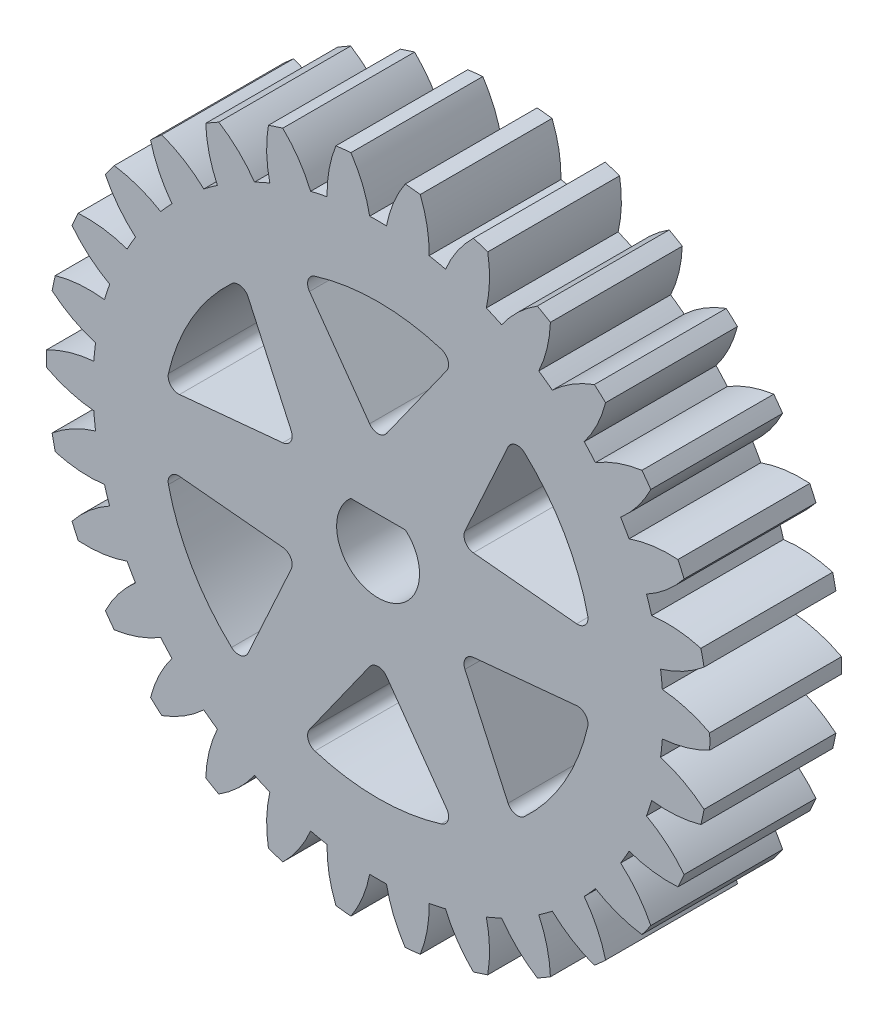
from build123d import *

# Parameters (mm, degrees)
SKETCH1_R                = 16
BOSS_EXTRUDE1_DEPTH      = 6.36
CUT_EXTRUDE1_DEPTH       = 24.504246425
CIRPATTERN1_COUNT        = 30
CUT_EXTRUDE4_DEPTH       = 24.467713412
CUT_EXTRUDE5_DEPTH       = 24.467713412
FILLET3_R                = 0.5
CIRPATTERN2_COUNT        = 6
FILLET3_OF_CIRPATTERN2_R = 0.5


with BuildPart() as part:
    # Sketch1 → Boss-Extrude1 (new body)
    with BuildSketch(Plane.XY):
        Circle(SKETCH1_R)
    extrude(amount=BOSS_EXTRUDE1_DEPTH)

    # Sketch3 → Cut-Extrude1 (cut, through all)
    with BuildSketch(Plane.XY.offset(6.36)):
        with BuildLine():
            ThreePointArc((-1.309972212, 15.946283981), (-0.747286699, 14.890480207), (-0.405262886, 13.744026411))
            ThreePointArc((-0.405262886, 13.744026411), (0, 13.75), (0.405262886, 13.744026411))
            ThreePointArc((0.405262886, 13.744026411), (0.747286699, 14.890480207), (1.309972212, 15.946283981))
            ThreePointArc((1.309972212, 15.946283981), (0, 16), (-1.309972212, 15.946283981))
        make_face()
    cut_extrude1 = extrude(amount=-CUT_EXTRUDE1_DEPTH, mode=Mode.SUBTRACT)

    # CirPattern1: Cut-Extrude1 ×30 about axis
    cirpattern1_axis = Axis((0, 0, 6.36), (0, 0, -1))
    for i in range(1, CIRPATTERN1_COUNT):
        add(cut_extrude1.rotate(cirpattern1_axis, i * 360 / CIRPATTERN1_COUNT), mode=Mode.SUBTRACT)

    # Sketch6 → Cut-Extrude4 (cut, through all)
    with BuildSketch(Plane(origin=(0, 0, 0), x_dir=(-1, 0, 0), z_dir=(0, 0, -1))):
        with BuildLine():
            Line((1.322875656, 1.5), (-1.322875656, 1.5))
            ThreePointArc((-1.322875656, 1.5), (0, -2), (1.322875656, 1.5))
        make_face()
    extrude(amount=-CUT_EXTRUDE4_DEPTH, mode=Mode.SUBTRACT)

    # Sketch7 → Cut-Extrude5 (cut, through all)
    with BuildSketch(Plane(origin=(0, 0, 0), x_dir=(-1, 0, 0), z_dir=(0, 0, -1))):
        with BuildLine():
            Line((0, 4.5), (3.695723463, 9.694444444))
            ThreePointArc((3.695723463, 9.694444444), (0, 10.375), (-3.695723463, 9.694444444))
            Line((-3.695723463, 9.694444444), (0, 4.5))
        make_face()
    cut_extrude5 = extrude(amount=-CUT_EXTRUDE5_DEPTH, mode=Mode.SUBTRACT)

    # Fillet3
    fillet3_edges = [part.edges().sort_by_distance(p)[0] for p in [
        (0, 4.5, 3.18),
        (-3.695723463, 9.694444444, 3.18),
        (3.695723463, 9.694444444, 3.18),
    ]]
    fillet(fillet3_edges, radius=FILLET3_R)

    # CirPattern2: Cut-Extrude5 ×6 about axis
    cirpattern2_axis = Axis((0, 0, 0), (0, 0, 1))
    for i in range(1, CIRPATTERN2_COUNT):
        add(cut_extrude5.rotate(cirpattern2_axis, i * 360 / CIRPATTERN2_COUNT), mode=Mode.SUBTRACT)

    # Fillet3 of CirPattern2
    fillet3_of_cirpattern2_edges = [part.edges().sort_by_distance(p)[0] for p in [
        (-3.897114317, 2.25, 3.18),
        (-10.243496896, 1.646631818, 3.18),
        (-6.547773433, 8.047812626, 3.18),
        (-3.897114317, -2.25, 3.18),
        (-6.547773433, -8.047812626, 3.18),
        (-10.243496896, -1.646631818, 3.18),
        (0, -4.5, 3.18),
        (3.695723463, -9.694444444, 3.18),
        (-3.695723463, -9.694444444, 3.18),
        (3.897114317, -2.25, 3.18),
        (10.243496896, -1.646631818, 3.18),
        (6.547773433, -8.047812626, 3.18),
        (3.897114317, 2.25, 3.18),
        (6.547773433, 8.047812626, 3.18),
        (10.243496896, 1.646631818, 3.18),
    ]]
    fillet(fillet3_of_cirpattern2_edges, radius=FILLET3_OF_CIRPATTERN2_R)


solid = part.part
